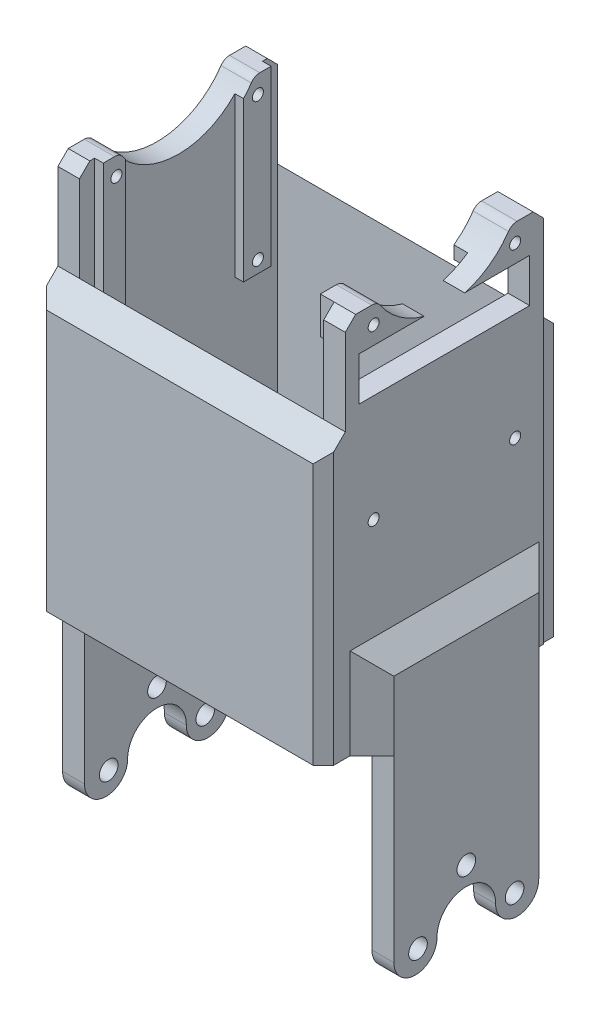
from build123d import *

# Parameters (mm, degrees)
BOSS_EXTRUDE1_DEPTH = 28.72
SKETCH2_R           = 11.2
CUT_EXTRUDE1_DEPTH  = 73.460862022
FILLET2_R           = 1.5
SKETCH3_W           = 41.45
SKETCH3_H           = 41
BOSS_EXTRUDE2_DEPTH = 3.175
SKETCH4_W           = 41.65
SKETCH4_H           = 41
BOSS_EXTRUDE3_DEPTH = 3.175
CHAMFER1_SIZE       = 3.175
CHAMFER2_SIZE       = 1.5
CHAMFER3_SIZE       = 1.5
BOSS_EXTRUDE4_START = 1.25
SKETCH5_R           = 0.8
BOSS_EXTRUDE4_DEPTH = 1.25
CUT_EXTRUDE2_REACH  = 74.059
SKETCH6_R           = 0.8
CUT_EXTRUDE3_REACH  = 76.34
SKETCH7_R           = 1.35
SKETCH8_R           = 0.8
SKETCH8_W           = 28.72
SKETCH8_H           = 4.5
SKETCH8_R_2         = 0.875750987
BOSS_EXTRUDE5_DEPTH = 2
CUT_EXTRUDE4_REACH  = 74.059
SKETCH9_R           = 0.800014392
SKETCH9_R_2         = 0.80001441
SKETCH9_R_3         = 0.800015836
SKETCH9_R_4         = 0.800011974
SKETCH9_W           = 24.720018
SKETCH9_H           = 6.307795688
BOSS_EXTRUDE6_DEPTH = 3.175
CHAMFER8_SIZE       = 3.175
CHAMFER9_SIZE       = 3.175
SKETCH11_R          = 1.35
CUT_EXTRUDE5_DEPTH  = 78.539065377


# Some blends are built 0.0001 mm under size
with BuildPart() as part:
    # Sketch1 → Boss-Extrude1 (new body)
    with BuildSketch(Plane.XY):
        Polygon((0, 0), (35.4, 0), (35.4, 51.875), (38.525, 51.875), (38.525, -3.125), (-3.125, -3.125), (-3.125, 51.875), (0, 51.875), align=None)
    extrude(amount=BOSS_EXTRUDE1_DEPTH)

    # Sketch2 → Cut-Extrude1 (cut, through all)
    with BuildSketch(Plane(origin=(38.525, 0, 0), x_dir=(0, 0, -1), z_dir=(1, 0, 0))):
        with Locations((-14.36, 57.485)):
            Circle(SKETCH2_R)
    extrude(amount=-CUT_EXTRUDE1_DEPTH, mode=Mode.SUBTRACT)

    # Fillet2
    fillet2_edges = [part.edges().sort_by_distance(p)[0] for p in [
        (-1.5625, 51.875, 4.666295858),
        (-1.5625, 51.875, 24.053704142),
        (36.9625, 51.875, 4.666295858),
        (36.9625, 51.875, 24.053704142),
    ]]
    fillet(fillet2_edges, radius=FILLET2_R)

    # Sketch3 → Boss-Extrude2 (add)
    with BuildSketch(Plane(origin=(0, 0, 0), x_dir=(-1, 0, 0), z_dir=(0, 0, -1))):
        with Locations((-17.6, 17.375)):
            Rectangle(SKETCH3_W, SKETCH3_H)
    extrude(amount=BOSS_EXTRUDE2_DEPTH)

    # Sketch4 → Boss-Extrude3 (add)
    with BuildSketch(Plane.XY.offset(28.72)):
        with Locations((17.7, 17.375)):
            Rectangle(SKETCH4_W, SKETCH4_H)
    extrude(amount=BOSS_EXTRUDE3_DEPTH)

    # Chamfer1
    chamfer1_edges = [part.edges().sort_by_distance(p)[0] for p in [
        (17.6, 37.875, -3.175),
        (17.7, 37.875, 31.895),
    ]]
    chamfer(chamfer1_edges, length=CHAMFER1_SIZE - 0.0001)  # a hair under: the kernel refuses the full size

    # Chamfer2
    chamfer2_edges = [part.edges().sort_by_distance(p)[0] for p in [
        (-1.5625, 51.875, 0),
        (36.9625, 51.875, 28.72),
        (-1.5625, 51.875, 28.72),
        (36.9625, 51.875, 0),
    ]]
    chamfer(chamfer2_edges, length=CHAMFER2_SIZE)

    # Chamfer3
    chamfer3_edges = [part.edges().sort_by_distance(p)[0] for p in [
        (38.325, 15.78755, -3.175),
        (-3.125, 15.78755, 31.895),
        (-3.125, 15.78755, -3.175),
        (38.525, 15.78755, 31.895),
    ]]
    chamfer(chamfer3_edges, length=CHAMFER3_SIZE)

    # Sketch5 → Boss-Extrude4 (add)
    # profile 1 of 2: a face of its own
    with BuildSketch(Plane(origin=(0, 0, 0), x_dir=(0, 0, -1), z_dir=(1, 0, 0)).offset(BOSS_EXTRUDE4_START)):
        with BuildLine():
            Line((-2.200583574, 26.790766865), (-2.200583574, 51.875))
            Line((-2.200583574, 51.875), (-3.836792314, 51.875))
            ThreePointArc((-3.836792314, 51.875), (-4.540480573, 51.699697262), (-5.07969086, 51.21476378))
            ThreePointArc((-5.07969086, 51.21476378), (-5.612003622, 50.491248548), (-6.200583574, 49.812717186))
            Line((-6.200583574, 49.812717186), (-6.200583574, 26.790766865))
            Line((-6.200583574, 26.790766865), (-2.200583574, 26.790766865))
        make_face()
        with Locations((-4.11, 28.560750667)):
            Circle(SKETCH5_R, mode=Mode.SUBTRACT)
        with Locations((-4.11, 49.260750667)):
            Circle(SKETCH5_R, mode=Mode.SUBTRACT)
    # profile 2 of 2: a face of its own
    with BuildSketch(Plane(origin=(0, 0, 0), x_dir=(0, 0, -1), z_dir=(1, 0, 0)).offset(BOSS_EXTRUDE4_START)):
        with BuildLine():
            Line((-23.282608993, 26.790766865), (-23.282608993, 50.715432159))
            ThreePointArc((-23.282608993, 50.715432159), (-23.464882765, 50.962645376), (-23.64030914, 51.21476378))
            ThreePointArc((-23.64030914, 51.21476378), (-24.179519427, 51.699697262), (-24.883207686, 51.875))
            Line((-24.883207686, 51.875), (-26.51940138, 51.875))
            Line((-26.51940138, 51.875), (-26.51940138, 26.790766865))
            Line((-26.51940138, 26.790766865), (-23.282608993, 26.790766865))
        make_face()
        with Locations((-24.61, 28.560750667)):
            Circle(SKETCH5_R, mode=Mode.SUBTRACT)
        with Locations((-24.61, 49.260750667)):
            Circle(SKETCH5_R, mode=Mode.SUBTRACT)
    extrude(amount=-BOSS_EXTRUDE4_DEPTH)

    # Sketch6 → Cut-Extrude2 (cut, up to next)
    with BuildSketch(Plane(origin=(0, 0, 0), x_dir=(0, 0, -1), z_dir=(1, 0, 0)), mode=Mode.PRIVATE) as cut_extrude2_sk1:
        with Locations((-24.61, 49.260750667)):
            Circle(SKETCH6_R)
    cut_extrude2_tool1 = extrude(cut_extrude2_sk1.sketch, amount=-CUT_EXTRUDE2_REACH, mode=Mode.PRIVATE) & part.part
    # Sketch6 → Cut-Extrude2 (cut, up to next)
    with BuildSketch(Plane(origin=(0, 0, 0), x_dir=(0, 0, -1), z_dir=(1, 0, 0)), mode=Mode.PRIVATE) as cut_extrude2_sk2:
        with Locations((-24.61, 28.560750667)):
            Circle(SKETCH6_R)
    cut_extrude2_tool2 = extrude(cut_extrude2_sk2.sketch, amount=-CUT_EXTRUDE2_REACH, mode=Mode.PRIVATE) & part.part
    # Sketch6 → Cut-Extrude2 (cut, up to next)
    with BuildSketch(Plane(origin=(0, 0, 0), x_dir=(0, 0, -1), z_dir=(1, 0, 0)), mode=Mode.PRIVATE) as cut_extrude2_sk3:
        with Locations((-4.11, 28.560750667)):
            Circle(SKETCH6_R)
    cut_extrude2_tool3 = extrude(cut_extrude2_sk3.sketch, amount=-CUT_EXTRUDE2_REACH, mode=Mode.PRIVATE) & part.part
    # Sketch6 → Cut-Extrude2 (cut, up to next)
    with BuildSketch(Plane(origin=(0, 0, 0), x_dir=(0, 0, -1), z_dir=(1, 0, 0)), mode=Mode.PRIVATE) as cut_extrude2_sk4:
        with Locations((-4.11, 49.260750667)):
            Circle(SKETCH6_R)
    cut_extrude2_tool4 = extrude(cut_extrude2_sk4.sketch, amount=-CUT_EXTRUDE2_REACH, mode=Mode.PRIVATE) & part.part
    add(cut_extrude2_tool1.solids().sort_by_distance((0, 49.260751, 24.61))[0], mode=Mode.SUBTRACT)
    add(cut_extrude2_tool2.solids().sort_by_distance((0, 28.560751, 24.61))[0], mode=Mode.SUBTRACT)
    add(cut_extrude2_tool3.solids().sort_by_distance((0, 28.560751, 4.11))[0], mode=Mode.SUBTRACT)
    add(cut_extrude2_tool4.solids().sort_by_distance((0, 49.260751, 4.11))[0], mode=Mode.SUBTRACT)

    # Sketch7 → Cut-Extrude3 (cut, up to next)
    with BuildSketch(Plane.XZ.offset(3.125), mode=Mode.PRIVATE) as cut_extrude3_sk1:
        with Locations(Location((11.7, 22.36, 0), (0, 0, 270))):
            Circle(SKETCH7_R)
    cut_extrude3_tool1 = extrude(cut_extrude3_sk1.sketch, amount=-CUT_EXTRUDE3_REACH, mode=Mode.PRIVATE) & part.part
    # Sketch7 → Cut-Extrude3 (cut, up to next)
    with BuildSketch(Plane.XZ.offset(3.125), mode=Mode.PRIVATE) as cut_extrude3_sk2:
        with Locations(Location((23.7, 22.36, 0), (0, 0, 270))):
            Circle(SKETCH7_R)
    cut_extrude3_tool2 = extrude(cut_extrude3_sk2.sketch, amount=-CUT_EXTRUDE3_REACH, mode=Mode.PRIVATE) & part.part
    # Sketch7 → Cut-Extrude3 (cut, up to next)
    with BuildSketch(Plane.XZ.offset(3.125), mode=Mode.PRIVATE) as cut_extrude3_sk3:
        with Locations(Location((23.7, 6.359998127, 0), (0, 0, 270))):
            Circle(SKETCH7_R)
    cut_extrude3_tool3 = extrude(cut_extrude3_sk3.sketch, amount=-CUT_EXTRUDE3_REACH, mode=Mode.PRIVATE) & part.part
    # Sketch7 → Cut-Extrude3 (cut, up to next)
    with BuildSketch(Plane.XZ.offset(3.125), mode=Mode.PRIVATE) as cut_extrude3_sk4:
        with Locations(Location((11.7, 6.359998127, 0), (0, 0, 270))):
            Circle(SKETCH7_R)
    cut_extrude3_tool4 = extrude(cut_extrude3_sk4.sketch, amount=-CUT_EXTRUDE3_REACH, mode=Mode.PRIVATE) & part.part
    add(cut_extrude3_tool1.solids().sort_by_distance((11.7, -3.125, 22.36))[0], mode=Mode.SUBTRACT)
    add(cut_extrude3_tool2.solids().sort_by_distance((23.7, -3.125, 22.36))[0], mode=Mode.SUBTRACT)
    add(cut_extrude3_tool3.solids().sort_by_distance((23.7, -3.125, 6.359998))[0], mode=Mode.SUBTRACT)
    add(cut_extrude3_tool4.solids().sort_by_distance((11.7, -3.125, 6.359998))[0], mode=Mode.SUBTRACT)

    # Sketch8 → Boss-Extrude5 (add)
    # profile 1 of 3: a face of its own
    with BuildSketch(Plane.ZY.offset(-35.4)):
        with BuildLine():
            ThreePointArc((23.64030914, 51.21476378), (22.377857963, 49.66490066), (20.86, 48.364144777))
            Line((20.86, 48.364144777), (20.86, 46.516373578))
            Line((20.86, 46.516373578), (27.22, 46.516373578))
            Line((27.22, 46.516373578), (27.22, 51.875))
            Line((27.22, 51.875), (24.883207686, 51.875))
            ThreePointArc((24.883207686, 51.875), (24.179519427, 51.699697262), (23.64030914, 51.21476378))
        make_face()
        with Locations(Location((24.61, 49.260750667, 0), (0, 0, 180))):
            Circle(SKETCH8_R, mode=Mode.SUBTRACT)
    # profile 2 of 3: a face of its own
    with BuildSketch(Plane.ZY.offset(-35.4)):
        with BuildLine():
            Line((3.836792314, 51.875), (1.5, 51.875))
            Line((1.5, 51.875), (1.5, 46.516373578))
            Line((1.5, 46.516373578), (7.86, 46.516373578))
            Line((7.86, 46.516373578), (7.86, 48.364144777))
            ThreePointArc((7.86, 48.364144777), (6.342142037, 49.66490066), (5.07969086, 51.21476378))
            ThreePointArc((5.07969086, 51.21476378), (4.540480573, 51.699697262), (3.836792314, 51.875))
        make_face()
        with Locations(Location((4.11, 49.260750667, 0), (0, 0, 180))):
            Circle(SKETCH8_R, mode=Mode.SUBTRACT)
    # profile 3 of 3: a face of its own
    with BuildSketch(Plane.ZY.offset(-35.4)):
        with Locations((14.36, 24.810750667)):
            Rectangle(SKETCH8_W, SKETCH8_H)
        with Locations((4.11, 24.810750667)):
            Circle(SKETCH8_R, mode=Mode.SUBTRACT)
        with Locations((24.61, 24.734999681)):
            Circle(SKETCH8_R_2, mode=Mode.SUBTRACT)
    extrude(amount=BOSS_EXTRUDE5_DEPTH)

    # Sketch9 → Cut-Extrude4 (cut, up to next)
    with BuildSketch(Plane.ZY.offset(-35.4), mode=Mode.PRIVATE) as cut_extrude4_sk1:
        with Locations((24.609993853, 24.810730685)):
            Circle(SKETCH9_R)
    cut_extrude4_tool1 = extrude(cut_extrude4_sk1.sketch, amount=-CUT_EXTRUDE4_REACH, mode=Mode.PRIVATE) & part.part
    # Sketch9 → Cut-Extrude4 (cut, up to next)
    with BuildSketch(Plane.ZY.offset(-35.4), mode=Mode.PRIVATE) as cut_extrude4_sk2:
        with Locations((4.109993853, 24.810730685)):
            Circle(SKETCH9_R_2)
    cut_extrude4_tool2 = extrude(cut_extrude4_sk2.sketch, amount=-CUT_EXTRUDE4_REACH, mode=Mode.PRIVATE) & part.part
    # Sketch9 → Cut-Extrude4 (cut, up to next)
    with BuildSketch(Plane.ZY.offset(-35.4), mode=Mode.PRIVATE) as cut_extrude4_sk3:
        with Locations((4.109993242, 49.260730684)):
            Circle(SKETCH9_R_3)
    cut_extrude4_tool3 = extrude(cut_extrude4_sk3.sketch, amount=-CUT_EXTRUDE4_REACH, mode=Mode.PRIVATE) & part.part
    # Sketch9 → Cut-Extrude4 (cut, up to next)
    with BuildSketch(Plane.ZY.offset(-35.4), mode=Mode.PRIVATE) as cut_extrude4_sk4:
        with Locations((24.609993853, 49.260730685)):
            Circle(SKETCH9_R_4)
    cut_extrude4_tool4 = extrude(cut_extrude4_sk4.sketch, amount=-CUT_EXTRUDE4_REACH, mode=Mode.PRIVATE) & part.part
    # Sketch9 → Cut-Extrude4 (cut, up to next)
    with BuildSketch(Plane.ZY.offset(-35.4), mode=Mode.PRIVATE) as cut_extrude4_sk5:
        with Locations((14.359996578, 43.522958594)):
            Rectangle(SKETCH9_W, SKETCH9_H)
    cut_extrude4_tool5 = extrude(cut_extrude4_sk5.sketch, amount=-CUT_EXTRUDE4_REACH, mode=Mode.PRIVATE) & part.part
    add(cut_extrude4_tool1.solids().sort_by_distance((35.4, 24.810731, 24.609994))[0], mode=Mode.SUBTRACT)
    add(cut_extrude4_tool2.solids().sort_by_distance((35.4, 24.810731, 4.109994))[0], mode=Mode.SUBTRACT)
    add(cut_extrude4_tool3.solids().sort_by_distance((35.4, 49.260731, 4.109993))[0], mode=Mode.SUBTRACT)
    add(cut_extrude4_tool4.solids().sort_by_distance((35.4, 49.260731, 24.609994))[0], mode=Mode.SUBTRACT)
    add(cut_extrude4_tool5.solids().sort_by_distance((35.4, 43.522959, 14.359997))[0], mode=Mode.SUBTRACT)

    # Sketch10 → Boss-Extrude6 (add)
    with BuildSketch(Plane.ZY.offset(3.125)):
        with BuildLine():
            Line((3.86000082, 6.875), (24.86000082, 6.875))
            Line((24.86000082, 6.875), (24.86000082, -29.069076968))
            add(Edge.make_bspline(
                [(18.609772252, -29.069076968), (18.609772252, -35.319305536), (24.86000082, -35.319305536), (24.86000082, -29.069076968)],
                knots=[0, 0, 0, 0, 1, 1, 1, 1], degree=3, weights=[1, 0.333333333, 0.333333333, 1]))
            add(Edge.make_bspline(
                [(10.110229389, -29.069076968), (10.084196873, -26.559098439), (11.849887296, -24.775), (14.36000082, -24.775), (16.870114345, -24.775), (18.635804768, -26.559098439), (18.609772252, -29.069076968)],
                knots=[0, 0, 0, 0, 0.5, 0.5, 0.5, 1, 1, 1, 1], degree=3, weights=[1, 0.802287003, 0.802287003, 1, 0.802287003, 0.802287003, 1]))
            add(Edge.make_bspline(
                [(3.86000082, -29.069077053), (3.86000082, -30.899726637), (5.154465564, -32.194191363), (6.985115147, -32.194191338), (8.815764731, -32.194191313), (10.110229439, -30.899726551), (10.110229389, -29.069076968)],
                knots=[0, 0, 0, 0, 0.5, 0.5, 0.5, 1, 1, 1, 1], degree=3, weights=[1, 0.804737851, 0.804737851, 1, 0.804737851, 0.804737851, 1]))
            Line((3.86000082, -29.069077053), (3.86000082, 6.875))
        make_face()
    boss_extrude6 = extrude(amount=BOSS_EXTRUDE6_DEPTH)

    # Chamfer8
    # the kernel refuses this chamfer: 3.175 mm, written as the material it adds along each edge
    with BuildSketch(Plane(origin=(-3.125, -3.125, 3.86000082), x_dir=(0, 0, -1), z_dir=(0, 1, 0))) as chamfer8_piece_1_section:
        Polygon((CHAMFER8_SIZE, 0), (0, CHAMFER8_SIZE), (0, 0), align=None)
    chamfer8_piece_1 = extrude(amount=18.165093487, mode=Mode.PRIVATE)
    chamfer8_piece_1 = split(chamfer8_piece_1, bisect_by=Plane(origin=(-9.7125, 3.4625, 3.86000082), z_dir=(0.7071067811865477, -0.7071067811865475, 0)), keep=Keep.TOP, mode=Mode.PRIVATE)
    add(chamfer8_piece_1)
    with BuildSketch(Plane(origin=(-3.125, 6.875, -4.305092666), x_dir=(0, 1, 0), z_dir=(0, 0, 1))) as chamfer8_piece_2_section:
        Polygon((CHAMFER8_SIZE, 0), (0, CHAMFER8_SIZE), (0, 0), align=None)
    chamfer8_piece_2 = extrude(amount=37.330186974, mode=Mode.PRIVATE)
    chamfer8_piece_2 = split(chamfer8_piece_2, bisect_by=Plane(origin=(-0.629953257, 6.875, -1.810045923), z_dir=(0.7071067811865476, 0, 0.7071067811865476)), keep=Keep.TOP, mode=Mode.PRIVATE)
    chamfer8_piece_2 = split(chamfer8_piece_2, bisect_by=Plane(origin=(-19.295046743, 6.875, 11.864954077), z_dir=(0.7071067811865477, 0, -0.7071067811865475)), keep=Keep.TOP, mode=Mode.PRIVATE)
    add(chamfer8_piece_2)
    with BuildSketch(Plane(origin=(-3.125, 15.040093487, 24.86000082), x_dir=(0, 0, 1), z_dir=(0, -1, 0))) as chamfer8_piece_3_section:
        Polygon((CHAMFER8_SIZE, 0), (0, CHAMFER8_SIZE), (0, 0), align=None)
    chamfer8_piece_3 = extrude(amount=18.165093487, mode=Mode.PRIVATE)
    chamfer8_piece_3 = split(chamfer8_piece_3, bisect_by=Plane(origin=(-0.629953257, 12.545046743, 24.86000082), z_dir=(0.7071067811865477, -0.7071067811865475, 0)), keep=Keep.TOP, mode=Mode.PRIVATE)
    add(chamfer8_piece_3)

    # Mirror2: Boss-Extrude6 across plane
    add(boss_extrude6.mirror(Plane(origin=(17.7, 0, 0), x_dir=(0, 0, 1), z_dir=(1, 0, 0))))

    # Chamfer9
    # the kernel refuses this chamfer: 3.175 mm, written as the material it adds along each edge
    with BuildSketch(Plane(origin=(38.525, 15.040093487, 24.86000082), x_dir=(1, 0, 0), z_dir=(0, -1, 0))) as chamfer9_piece_1_section:
        Polygon((CHAMFER9_SIZE, 0), (0, CHAMFER9_SIZE), (0, 0), align=None)
    chamfer9_piece_1 = extrude(amount=18.165093487, mode=Mode.PRIVATE)
    chamfer9_piece_1 = split(chamfer9_piece_1, bisect_by=Plane(origin=(36.029953257, 12.545046743, 24.86000082), z_dir=(-0.7071067811865488, -0.7071067811865464, 0)), keep=Keep.TOP, mode=Mode.PRIVATE)
    add(chamfer9_piece_1)
    with BuildSketch(Plane(origin=(38.525, 6.875, -4.305092666), x_dir=(1, 0, 0), z_dir=(0, 0, 1))) as chamfer9_piece_2_section:
        Polygon((CHAMFER9_SIZE, 0), (0, CHAMFER9_SIZE), (0, 0), align=None)
    chamfer9_piece_2 = extrude(amount=37.330186974, mode=Mode.PRIVATE)
    chamfer9_piece_2 = split(chamfer9_piece_2, bisect_by=Plane(origin=(36.029953257, 6.875, -1.810045923), z_dir=(-0.7071067811865488, 0, 0.7071067811865464)), keep=Keep.TOP, mode=Mode.PRIVATE)
    chamfer9_piece_2 = split(chamfer9_piece_2, bisect_by=Plane(origin=(54.695046743, 6.875, 11.864954077), z_dir=(-0.7071067811865488, 0, -0.7071067811865464)), keep=Keep.TOP, mode=Mode.PRIVATE)
    add(chamfer9_piece_2)
    with BuildSketch(Plane(origin=(38.525, -3.125, 3.86000082), x_dir=(1, 0, 0), z_dir=(0, 1, 0))) as chamfer9_piece_3_section:
        Polygon((CHAMFER9_SIZE, 0), (0, CHAMFER9_SIZE), (0, 0), align=None)
    chamfer9_piece_3 = extrude(amount=18.165093487, mode=Mode.PRIVATE)
    chamfer9_piece_3 = split(chamfer9_piece_3, bisect_by=Plane(origin=(45.1125, 3.4625, 3.86000082), z_dir=(-0.7071067811865488, -0.7071067811865464, 0)), keep=Keep.TOP, mode=Mode.PRIVATE)
    add(chamfer9_piece_3)

    # Sketch11 → Cut-Extrude5 (cut, through all)
    with BuildSketch(Plane.ZY.offset(6.3)):
        with Locations((7.36000082, -29.069077053)):
            Circle(SKETCH11_R)
        with Locations((14.36000082, -22.069077053)):
            Circle(SKETCH11_R)
        with Locations((21.36000082, -29.069077053)):
            Circle(SKETCH11_R)
    extrude(amount=-CUT_EXTRUDE5_DEPTH, mode=Mode.SUBTRACT)


solid = part.part
